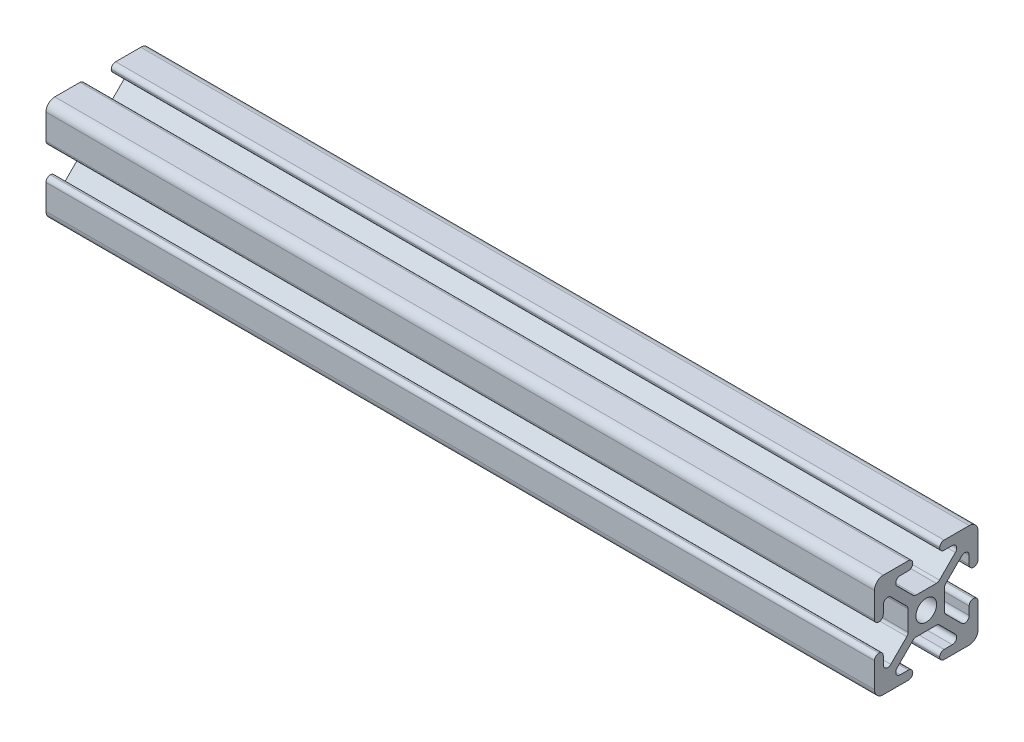
from build123d import *

# Parameters (mm, degrees)
SKETCH1_R           = 2.5
BOSS_EXTRUDE1_DEPTH = 200
FILLET1_R           = 1.065
FILLET2_R           = 2.13


with BuildPart() as part:
    # Sketch1 → Boss-Extrude1 (new body)
    with BuildSketch(Plane.YZ):
        Polygon((-12.5, -3.25), (-12.5, -12.5), (-3.25, -12.5), (-3.25, -10.37), (-8.863862556, -10.37), (-2.873862556, -4.38), (2.873862556, -4.38), (8.863862556, -10.37), (3.25, -10.37), (3.25, -12.5), (12.5, -12.5), (12.5, -3.25), (10.37, -3.25), (10.37, -8.863862556), (4.38, -2.873862556), (4.38, 2.873862556), (10.37, 8.863862556), (10.37, 3.25), (12.5, 3.25), (12.5, 12.5), (3.25, 12.5), (3.25, 10.37), (8.863862556, 10.37), (2.873862556, 4.38), (-2.873862556, 4.38), (-8.863862556, 10.37), (-3.25, 10.37), (-3.25, 12.5), (-12.5, 12.5), (-12.5, 3.25), (-10.37, 3.25), (-10.37, 8.863862556), (-4.38, 2.873862556), (-4.38, -2.873862556), (-10.37, -8.863862556), (-10.37, -3.25), align=None)
        with Locations(Location((0, 0, 0), (0, 0, 270))):
            Circle(SKETCH1_R, mode=Mode.SUBTRACT)
    extrude(amount=BOSS_EXTRUDE1_DEPTH)

    # Fillet1
    fillet1_edges = [part.edges().sort_by_distance(p)[0] for p in [
        (100, -10.37, -8.863862556),
        (100, 2.873862556, -4.38),
        (100, -2.873862556, -4.38),
        (100, -4.38, 2.873862556),
        (100, -4.38, -2.873862556),
        (100, -2.873862556, 4.38),
        (100, 2.873862556, 4.38),
        (100, 4.38, 2.873862556),
        (100, 4.38, -2.873862556),
        (100, -8.863862556, -10.37),
        (100, 8.863862556, -10.37),
        (100, 10.37, -8.863862556),
        (100, -10.37, 8.863862556),
        (100, -8.863862556, 10.37),
        (100, 10.37, 8.863862556),
        (100, 8.863862556, 10.37),
        (100, 12.5, 3.25),
        (100, -3.25, -12.5),
        (100, -10.37, 3.25),
        (100, 10.37, 3.25),
        (100, -10.37, -3.25),
        (100, -12.5, -3.25),
        (100, -12.5, 3.25),
        (100, 3.25, -10.37),
        (100, -3.25, -10.37),
        (100, 3.25, -12.5),
        (100, 10.37, -3.25),
        (100, 12.5, -3.25),
        (100, 3.25, 12.5),
        (100, 3.25, 10.37),
        (100, -3.25, 10.37),
        (100, -3.25, 12.5),
    ]]
    fillet(fillet1_edges, radius=FILLET1_R - 0.0001)  # a hair under: the kernel refuses the full size

    # Fillet2
    fillet2_edges = [part.edges().sort_by_distance(p)[0] for p in [
        (100, -12.5, 12.5),
        (100, 12.5, 12.5),
        (100, 12.5, -12.5),
        (100, -12.5, -12.5),
    ]]
    fillet(fillet2_edges, radius=FILLET2_R)


solid = part.part
